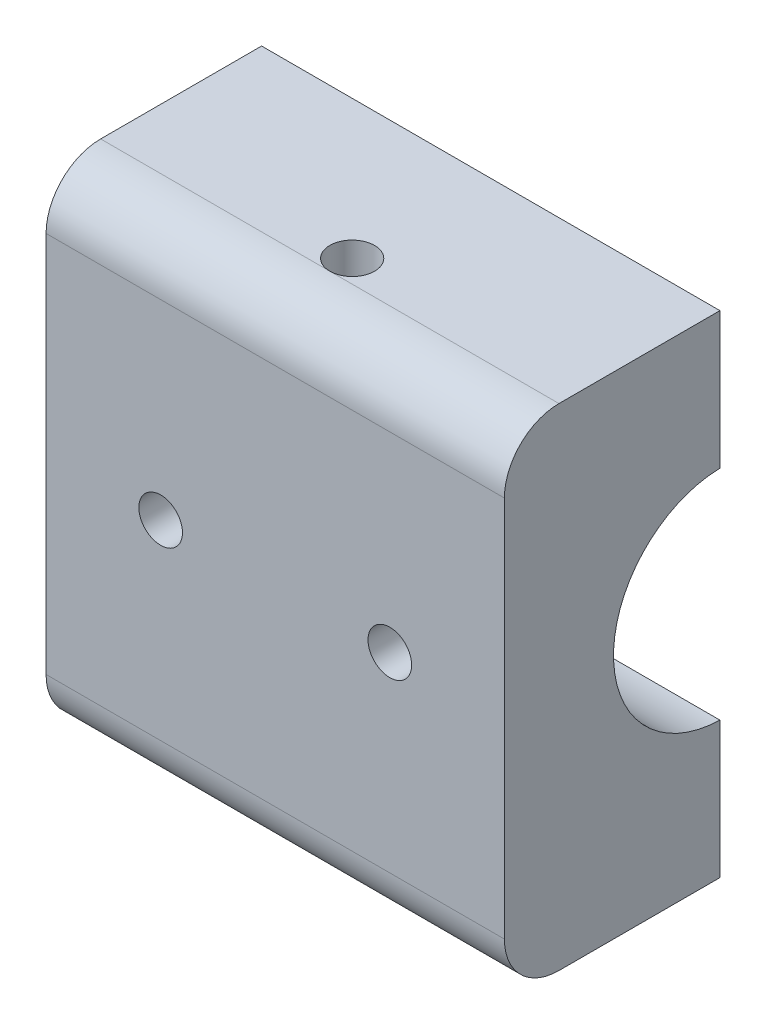
from build123d import *

# Parameters (mm, degrees)
BOSS_EXTRUDE1_DEPTH = 42
SKETCH4_R           = 2
CUT_EXTRUDE4_DEPTH  = 52.578217301
SKETCH5_R           = 2.05
CUT_EXTRUDE5_DEPTH  = 65.722484597


with BuildPart() as part:
    # Sketch1 → Boss-Extrude1 (new body)
    with BuildSketch(Plane(origin=(0, 0, 0), x_dir=(0, 0, -1), z_dir=(1, 0, 0))):
        with BuildLine():
            Line((-0.25, 9.996874512), (-0.25, 22.5))
            Line((-0.25, 22.5), (-15, 22.5))
            ThreePointArc((-15, 22.5), (-18.535533906, 21.035533906), (-20, 17.5))
            Line((-20, 17.5), (-20, -17.5))
            ThreePointArc((-20, -17.5), (-18.535533906, -21.035533906), (-15, -22.5))
            Line((-15, -22.5), (-0.25, -22.5))
            Line((-0.25, -22.5), (-0.25, -9.996874512))
            ThreePointArc((-0.25, -9.996874512), (-10, 0), (-0.25, 9.996874512))
        make_face()
    extrude(amount=-BOSS_EXTRUDE1_DEPTH)

    # Sketch4 → Cut-Extrude4 (cut, through all)
    with BuildSketch(Plane.XY.offset(20)):
        with Locations((-10.5, 0)):
            Circle(SKETCH4_R)
        with Locations((-31.5, 0)):
            Circle(SKETCH4_R)
    extrude(amount=-CUT_EXTRUDE4_DEPTH, mode=Mode.SUBTRACT)

    # Sketch5 → Cut-Extrude5 (cut, through all)
    with BuildSketch(Plane.XZ.offset(22.5)):
        with Locations((-21, 12.95)):
            Circle(SKETCH5_R)
    extrude(amount=-CUT_EXTRUDE5_DEPTH, mode=Mode.SUBTRACT)


solid = part.part
